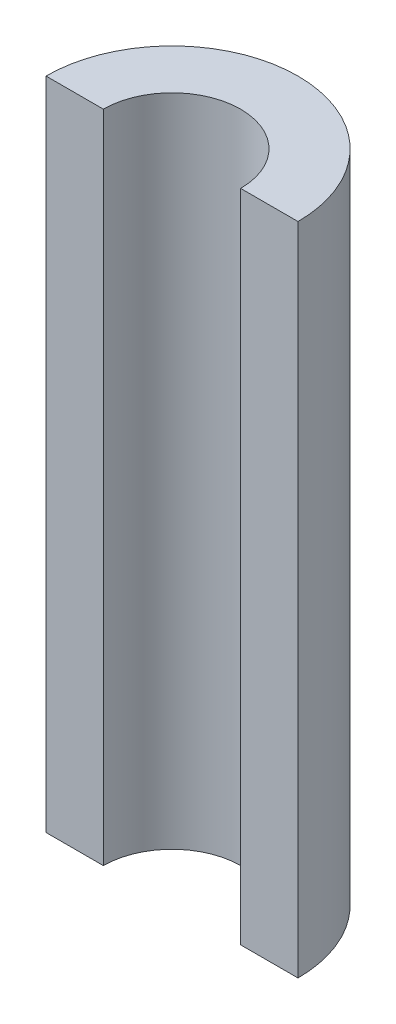
from build123d import *

# Parameters (mm, degrees)
BOSS_EXTRUDE1_DEPTH     = 107.315
CUT_EXTRUDE1_DEPTH      = 223.425916093
CUT_EXTRUDE1_DEPTH_BACK = 223.425916093
SKETCH3_R               = 22.479


with BuildPart() as part:
    # Sketch1 → Boss-Extrude1 (new, symmetric)
    with BuildSketch(Plane(origin=(0, 0, 0), x_dir=(-1, 0, 0), z_dir=(0, 1, 0))):
        with BuildLine():
            Line((-41.275, 0), (41.275, 0))
            ThreePointArc((41.275, 0), (0, -41.275), (-41.275, 0))
        make_face()
    extrude(amount=BOSS_EXTRUDE1_DEPTH, both=True)

    # Sketch3 → Cut-Extrude1 (cut, two sides: drawn at the far end of the back side and taken through both)
    with BuildSketch(Plane(origin=(0, 107.315, 0), x_dir=(-1, 0, 0), z_dir=(0, 1, 0)).offset(-CUT_EXTRUDE1_DEPTH_BACK)):
        Circle(SKETCH3_R)
    extrude(amount=CUT_EXTRUDE1_DEPTH + CUT_EXTRUDE1_DEPTH_BACK, mode=Mode.SUBTRACT)


solid = part.part
